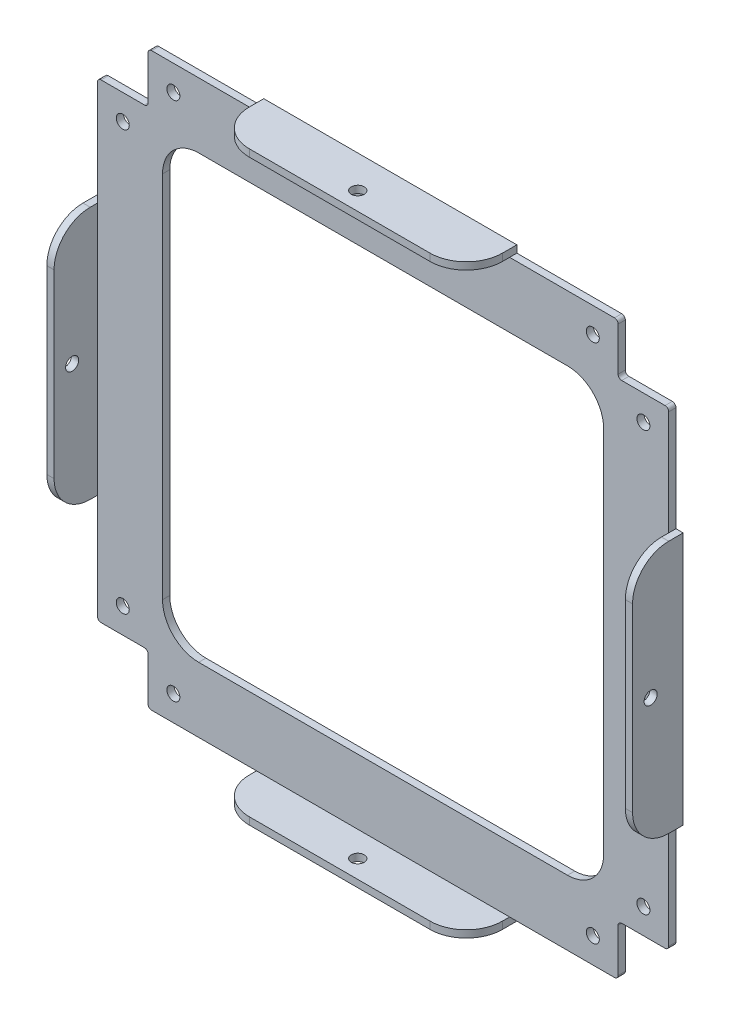
from build123d import *

# Parameters (mm, degrees)
SKETCH1_W                  = 79
SKETCH1_H                  = 79
BOSS_EXTRUDE1_DEPTH        = 0.5
BOSS_EXTRUDE2_DEPTH        = 6
BOSS_EXTRUDE2_DEPTH_BACK   = 1
SKETCH2_W                  = 35
SKETCH2_H                  = 1
SKETCH2_W_2                = 1
SKETCH2_H_2                = 35
CUT_EXTRUDE1_DEPTH         = 10
M1_6_CLEARANCE_HOLE1_D     = 1.8
M1_6_CLEARANCE_HOLE2_D     = 1.8
M1_6_CLEARANCE_HOLE2_DEPTH = 200
M1_6_CLEARANCE_HOLE2_TIP   = 0.540774557
FILLET1_R                  = 5
CUT_EXTRUDE2_DEPTH         = 10
M1_6_CLEARANCE_HOLE3_D     = 1.8
M1_6_CLEARANCE_HOLE3_DEPTH = 200
M1_6_CLEARANCE_HOLE3_TIP   = 0.540774557


with BuildPart() as part:
    # Sketch1 → Boss-Extrude1 (new, symmetric)
    with BuildSketch(Plane.XY):
        Rectangle(SKETCH1_W, SKETCH1_H)
    extrude(amount=BOSS_EXTRUDE1_DEPTH, both=True)

    # Sketch2 → Boss-Extrude2 (add, two sides: drawn at the far end of the back side and taken through both)
    with BuildSketch(Plane.XY.offset(0.5).offset(-BOSS_EXTRUDE2_DEPTH_BACK)):
        with Locations((0, 40)):
            Rectangle(SKETCH2_W, SKETCH2_H)
        with Locations((-40, 0)):
            Rectangle(SKETCH2_W_2, SKETCH2_H_2)
        with Locations((0, -40)):
            Rectangle(SKETCH2_W, SKETCH2_H)
        with Locations((40, 0)):
            Rectangle(SKETCH2_W_2, SKETCH2_H_2)
    extrude(amount=BOSS_EXTRUDE2_DEPTH + BOSS_EXTRUDE2_DEPTH_BACK)

    # Sketch9 → Cut-Extrude1 (cut)
    with BuildSketch(Plane.XY.offset(0.5)):
        with BuildLine():
            Line((-25.5, -30.5), (25.5, -30.5))
            ThreePointArc((25.5, -30.5), (29.035533906, -29.035533906), (30.5, -25.5))
            Line((30.5, -25.5), (30.5, 25.5))
            ThreePointArc((30.5, 25.5), (29.035533906, 29.035533906), (25.5, 30.5))
            Line((25.5, 30.5), (-25.5, 30.5))
            ThreePointArc((-25.5, 30.5), (-29.035533906, 29.035533906), (-30.5, 25.5))
            Line((-30.5, 25.5), (-30.5, -25.5))
            ThreePointArc((-30.5, -25.5), (-29.035533906, -29.035533906), (-25.5, -30.5))
        make_face()
    extrude(amount=-CUT_EXTRUDE1_DEPTH, mode=Mode.SUBTRACT)

    # M1.6 Clearance Hole1 (through all)
    with Locations(Plane(origin=(0, 40.5, 0), x_dir=(1, 0, 0), z_dir=(0, 1, 0))):
        with Locations((0, -4)):
            Hole(M1_6_CLEARANCE_HOLE1_D / 2)

    # M1.6 Clearance Hole2
    with Locations(Plane.ZY.offset(40.5)):
        with Locations((4, 0)):
            Hole(M1_6_CLEARANCE_HOLE2_D / 2, depth=M1_6_CLEARANCE_HOLE2_DEPTH)
            with Locations((0, 0, -(M1_6_CLEARANCE_HOLE2_DEPTH + M1_6_CLEARANCE_HOLE2_TIP / 2))):  # 118° drill point
                Cone(0, M1_6_CLEARANCE_HOLE2_D / 2, M1_6_CLEARANCE_HOLE2_TIP, mode=Mode.SUBTRACT)

    # Fillet1
    fillet1_edges = [part.edges().sort_by_distance(p)[0] for p in [
        (-40, 17.5, 6.5),
        (-40, -17.5, 6.5),
        (-17.5, -40, 6.5),
        (17.5, -40, 6.5),
        (40, -17.5, 6.5),
        (40, 17.5, 6.5),
        (17.5, 40, 6.5),
        (-17.5, 40, 6.5),
    ]]
    fillet(fillet1_edges, radius=FILLET1_R)

    # Sketch15 → Cut-Extrude2 (cut)
    with BuildSketch(Plane.XY.offset(0.5)):
        with BuildLine():
            Line((-39.5, 39.5), (-32, 39.5))
            ThreePointArc((-32, 39.5), (-32.353553391, 39.353553391), (-32.5, 39))
            Line((-32.5, 39), (-32.5, 33))
            ThreePointArc((-32.5, 33), (-32.646446609, 32.646446609), (-33, 32.5))
            Line((-33, 32.5), (-39, 32.5))
            ThreePointArc((-39, 32.5), (-39.353553391, 32.353553391), (-39.5, 32))
            Line((-39.5, 32), (-39.5, 39.5))
        make_face()
        with BuildLine():
            Line((39.5, 39.5), (32, 39.5))
            ThreePointArc((32, 39.5), (32.353553391, 39.353553391), (32.5, 39))
            Line((32.5, 39), (32.5, 33))
            ThreePointArc((32.5, 33), (32.646446609, 32.646446609), (33, 32.5))
            Line((33, 32.5), (39, 32.5))
            ThreePointArc((39, 32.5), (39.353553391, 32.353553391), (39.5, 32))
            Line((39.5, 32), (39.5, 39.5))
        make_face()
        with BuildLine():
            Line((-39.5, -39.5), (-32, -39.5))
            ThreePointArc((-32, -39.5), (-32.353553391, -39.353553391), (-32.5, -39))
            Line((-32.5, -39), (-32.5, -33))
            ThreePointArc((-32.5, -33), (-32.646446609, -32.646446609), (-33, -32.5))
            Line((-33, -32.5), (-39, -32.5))
            ThreePointArc((-39, -32.5), (-39.353553391, -32.353553391), (-39.5, -32))
            Line((-39.5, -32), (-39.5, -39.5))
        make_face()
        with BuildLine():
            Line((39.5, -39.5), (32, -39.5))
            ThreePointArc((32, -39.5), (32.353553391, -39.353553391), (32.5, -39))
            Line((32.5, -39), (32.5, -33))
            ThreePointArc((32.5, -33), (32.646446609, -32.646446609), (33, -32.5))
            Line((33, -32.5), (39, -32.5))
            ThreePointArc((39, -32.5), (39.353553391, -32.353553391), (39.5, -32))
            Line((39.5, -32), (39.5, -39.5))
        make_face()
    extrude(amount=-CUT_EXTRUDE2_DEPTH, mode=Mode.SUBTRACT)

    # M1.6 Clearance Hole3
    with Locations(Plane.XY.offset(0.5)):
        with Locations((-29, 36), (-36, 29), (-36, -29), (-29, -36), (29, -36), (36, -29), (36, 29), (29, 36)):
            Hole(M1_6_CLEARANCE_HOLE3_D / 2, depth=M1_6_CLEARANCE_HOLE3_DEPTH)
            with Locations((0, 0, -(M1_6_CLEARANCE_HOLE3_DEPTH + M1_6_CLEARANCE_HOLE3_TIP / 2))):  # 118° drill point
                Cone(0, M1_6_CLEARANCE_HOLE3_D / 2, M1_6_CLEARANCE_HOLE3_TIP, mode=Mode.SUBTRACT)


solid = part.part
